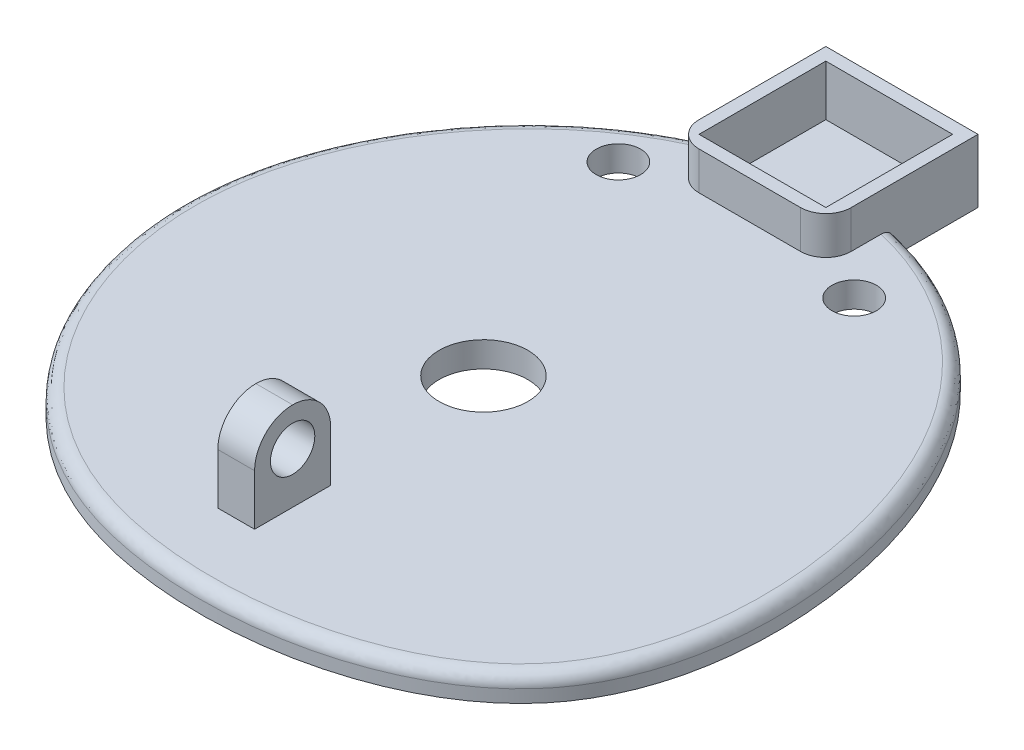
from build123d import *

# Parameters (mm, degrees)
BOSS_EXTRUDE1_DEPTH = 2
SKETCH53_R          = 3.5
CUT_EXTRUDE1_DEPTH  = 39.196778302
CUT_EXTRUDE2_REACH  = 40.197
SKETCH54_R          = 1.75
SKETCH58_W          = 2.9
SKETCH58_H          = 6
BOSS_EXTRUDE3_DEPTH = 7
CUT_EXTRUDE5_REACH  = 40.206
SKETCH59_R          = 1.75
FILLET2_R           = 3
SKETCH62_W          = 12
SKETCH62_H          = 12
BOSS_EXTRUDE5_DEPTH = 5
SKETCH63_W          = 10
SKETCH63_H          = 10
CUT_EXTRUDE6_DEPTH  = 4
FILLET4_R           = 2
FILLET5_R           = 1


with BuildPart() as part:
    # Sketch1 → Boss-Extrude1 (new body)
    with BuildSketch(Plane.XZ):
        with BuildLine():
            add(Edge.make_bspline(
                [(-5, -26), (7.786549371, -29.827455575), (28.431061215, -18.009613356), (27.073140257, 23.791056835), (-13.092194035, 29.335293652), (-31.25538501, -3.658967579), (-15.156693843, -22.959750959), (-5, -26)],
                knots=[0, 0, 0, 0, 0.296836273, 0.417767996, 0.576795533, 0.764215109, 1, 1, 1, 1], degree=3))
        make_face()
    extrude(amount=-BOSS_EXTRUDE1_DEPTH)

    # Sketch53 → Cut-Extrude1 (cut, through all)
    with BuildSketch(Plane.XZ):
        with Locations(Location((0, 0, 0), (0, 0, 270))):
            Circle(SKETCH53_R)
    extrude(amount=-CUT_EXTRUDE1_DEPTH, mode=Mode.SUBTRACT)

    # Sketch54 → Cut-Extrude2 (cut, up to next)
    with BuildSketch(Plane(origin=(0, 2, 0), x_dir=(1, 0, 0), z_dir=(0, 1, 0)), mode=Mode.PRIVATE) as cut_extrude2_sk1:
        with Locations(Location((9.297601758, 19.938771315, 0), (0, 0, 270))):
            Circle(SKETCH54_R)
    cut_extrude2_tool1 = extrude(cut_extrude2_sk1.sketch, amount=-CUT_EXTRUDE2_REACH, mode=Mode.PRIVATE) & part.part
    # Sketch54 → Cut-Extrude2 (cut, up to next)
    with BuildSketch(Plane(origin=(0, 2, 0), x_dir=(1, 0, 0), z_dir=(0, 1, 0)), mode=Mode.PRIVATE) as cut_extrude2_sk2:
        with Locations(Location((-9.297601758, 19.938771315, 0), (0, 0, 270))):
            Circle(SKETCH54_R)
    cut_extrude2_tool2 = extrude(cut_extrude2_sk2.sketch, amount=-CUT_EXTRUDE2_REACH, mode=Mode.PRIVATE) & part.part
    add(cut_extrude2_tool1.solids().sort_by_distance((9.297602, 2, -19.938771))[0], mode=Mode.SUBTRACT)
    add(cut_extrude2_tool2.solids().sort_by_distance((-9.297602, 2, -19.938771))[0], mode=Mode.SUBTRACT)

    # Sketch58 → Boss-Extrude3 (add)
    with BuildSketch(Plane(origin=(0, 2, 0), x_dir=(1, 0, 0), z_dir=(0, 1, 0))):
        with Locations((0, -16.5)):
            Rectangle(SKETCH58_W, SKETCH58_H)
    extrude(amount=BOSS_EXTRUDE3_DEPTH)

    # Sketch59 → Cut-Extrude5 (cut, up to next)
    with BuildSketch(Plane(origin=(1.45, 0, 0), x_dir=(0, 0, -1), z_dir=(1, 0, 0)), mode=Mode.PRIVATE) as cut_extrude5_sk1:
        with Locations((-16.5, 6)):
            Circle(SKETCH59_R)
    cut_extrude5_tool1 = extrude(cut_extrude5_sk1.sketch, amount=-CUT_EXTRUDE5_REACH, mode=Mode.PRIVATE) & part.part
    add(cut_extrude5_tool1.solids().sort_by_distance((1.45, 6, 16.5))[0], mode=Mode.SUBTRACT)

    # Fillet2
    fillet2_edges = [part.edges().sort_by_distance(p)[0] for p in [
        (0, 9, 13.5),
        (0, 9, 19.5),
    ]]
    fillet(fillet2_edges, radius=FILLET2_R - 0.0001)  # a hair under: the kernel refuses the full size

    # Sketch62 → Boss-Extrude5 (add)
    with BuildSketch(Plane(origin=(0, 0, 0), x_dir=(1, 0, 0), z_dir=(0, 1, 0))):
        with Locations((0, 27)):
            Rectangle(SKETCH62_W, SKETCH62_H)
    extrude(amount=BOSS_EXTRUDE5_DEPTH)

    # Sketch63 → Cut-Extrude6 (cut)
    with BuildSketch(Plane(origin=(0, 5, 0), x_dir=(1, 0, 0), z_dir=(0, 1, 0))):
        with Locations((0, 27)):
            Rectangle(SKETCH63_W, SKETCH63_H)
    extrude(amount=-CUT_EXTRUDE6_DEPTH, mode=Mode.SUBTRACT)

    # Fillet4
    fillet4_edges = [part.edges().sort_by_distance(p)[0] for p in [
        (6, 3.5, -21),
        (-6, 3.5, -21),
    ]]
    fillet(fillet4_edges, radius=FILLET4_R)

    # Fillet5
    fillet5_edges = [part.edges().sort_by_distance(p)[0] for p in [
        (3.875911824, 2, 25.42804335),
    ]]
    fillet(fillet5_edges, radius=FILLET5_R)


solid = part.part
